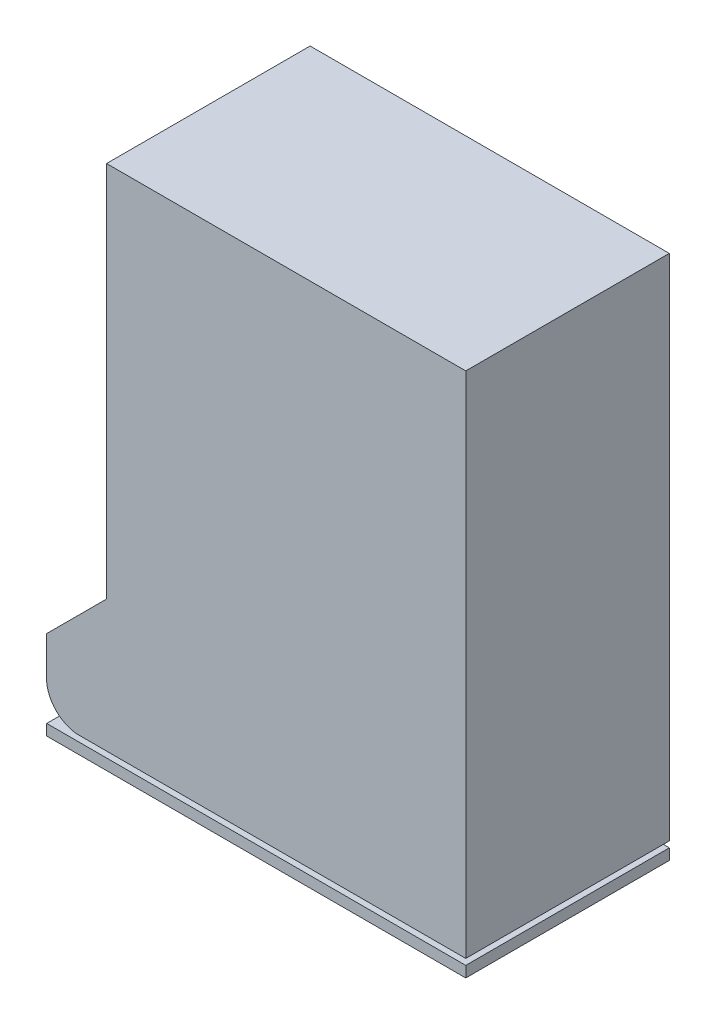
from build123d import *

# Parameters (mm, degrees)
SKETCH1_W            = 56
SKETCH1_H            = 30
BOSS_EXTRUDE1_DEPTH  = 2
SKETCH2_W            = 60
SKETCH2_H            = 34
SKETCH2_W_2          = 56
SKETCH2_H_2          = 30
BOSS_EXTRUDE2_DEPTH  = 85
BOSS_EXTRUDE3_DEPTH  = 10
SKETCH5_W            = 34
SKETCH5_H            = 2
BOSS_EXTRUDE5_DEPTH  = 10
CHAMFER2_SIZE        = 10
BOSS_EXTRUDE6_START  = 2
BOSS_EXTRUDE6_DEPTH  = 8
SKETCH7_R            = 2.25
CUT_EXTRUDE1_DEPTH   = 99.208960895
BOSS_EXTRUDE7_REACH  = 100.209
SKETCH9_R            = 2.25
BOSS_EXTRUDE8_REACH  = 100.209
SKETCH10_R           = 2.25
BOSS_EXTRUDE9_REACH  = 100.209
SKETCH11_R           = 1.75
SKETCH12_W           = 8
SKETCH12_H           = 28.34314575
BOSS_EXTRUDE10_DEPTH = 1
BOSS_EXTRUDE11_DEPTH = 8
SKETCH14_W           = 34
SKETCH14_H           = 1.828427125
BOSS_EXTRUDE12_DEPTH = 62
FILLET1_R            = 4
CUT_EXTRUDE2_REACH   = 102.611
CUT_EXTRUDE3_REACH   = 102.611


# Some blends are built 0.0001 mm under size
with BuildPart() as part:
    # Sketch1 → Boss-Extrude1 (new body)
    with BuildSketch(Plane(origin=(0, 0, 0), x_dir=(1, 0, 0), z_dir=(0, 1, 0))):
        Rectangle(SKETCH1_W, SKETCH1_H)
    extrude(amount=BOSS_EXTRUDE1_DEPTH)

    # Sketch2 → Boss-Extrude2 (add)
    with BuildSketch(Plane(origin=(0, 2, 0), x_dir=(1, 0, 0), z_dir=(0, 1, 0))):
        Rectangle(SKETCH2_W, SKETCH2_H)
        Rectangle(SKETCH2_W_2, SKETCH2_H_2, mode=Mode.SUBTRACT)
    extrude(amount=-BOSS_EXTRUDE2_DEPTH)

    # Sketch3 → Boss-Extrude3 (add)
    with BuildSketch(Plane.ZY.offset(30)):
        Polygon((17, -83), (17, -73), (7.299704714, -73), (7, -73), (7.299704714, -73.299704714), align=None)
        Polygon((-17, -73), (-17, -83), (-10.046245332, -76.046245332), (-7.299704714, -73.299704714), (-7, -73), (-7.299704714, -73), align=None)
    extrude(amount=BOSS_EXTRUDE3_DEPTH)

    # Sketch5 → Boss-Extrude5 (add)
    with BuildSketch(Plane.ZY.offset(30)):
        with Locations((0, -72)):
            Rectangle(SKETCH5_W, SKETCH5_H)
    extrude(amount=BOSS_EXTRUDE5_DEPTH)

    # Chamfer2
    chamfer2_edges = [part.edges().sort_by_distance(p)[0] for p in [
        (-30, -71, 0),
    ]]
    chamfer(chamfer2_edges, length=CHAMFER2_SIZE - 0.0001)  # a hair under: the kernel refuses the full size


with BuildPart() as body_2:
    # Sketch6 → Boss-Extrude6 (new body)
    with BuildSketch(Plane.ZY.offset(30).offset(BOSS_EXTRUDE6_START)):
        Polygon((12.171572875, -81), (14.171572875, -83), (-14.171572875, -83), (-12.171572875, -81), (-6.171572875, -75), (6.171572875, -75), align=None)
    extrude(amount=BOSS_EXTRUDE6_DEPTH)


with BuildPart() as cut_extrude1_tool:
    # Sketch7 → Cut-Extrude1 (new, through all)
    with BuildSketch(Plane.XY.offset(17)):
        with Locations(Location((-36, -79, 0), (0, 0, 270))):
            Circle(SKETCH7_R)
    extrude(amount=-CUT_EXTRUDE1_DEPTH)


with BuildPart() as part_1:
    add(part.part)

    # Cut-Extrude1: cut by cut_extrude1_tool
    add(cut_extrude1_tool.part, mode=Mode.SUBTRACT)

    # Boss-Extrude7: up to this face of the body (flat: up to its plane)
    boss_extrude7_end = Plane(part_1.part.faces().sort_by_distance((-35, -73.122474487, 7.122474487))[0])
    # Sketch9 → Boss-Extrude7 (add, up to the picked face)
    with BuildSketch(Plane.XY.offset(17), mode=Mode.PRIVATE) as boss_extrude7_sk1:
        with Locations(Location((-36, -79, 0), (0, 0, 270))):
            Circle(SKETCH9_R)
    boss_extrude7_tool1 = split(extrude(boss_extrude7_sk1.sketch, amount=-BOSS_EXTRUDE7_REACH, mode=Mode.PRIVATE), bisect_by=boss_extrude7_end, keep=Keep.BOTH, mode=Mode.PRIVATE)
    add(boss_extrude7_tool1.solids().sort_by(Axis((-36, -79, 17), (0, 0, -1)))[0])

    # Boss-Extrude8: up to this face of the body (flat: up to its plane)
    boss_extrude8_end = Plane(part_1.part.faces().sort_by_distance((-35, -82.877525513, -16.877525513))[0])
    # Sketch10 → Boss-Extrude8 (add, up to the picked face)
    with BuildSketch(Plane(origin=(0, 0, -17), x_dir=(-1, 0, 0), z_dir=(0, 0, -1)), mode=Mode.PRIVATE) as boss_extrude8_sk1:
        with Locations(Location((36, -79, 0), (0, 0, 270))):
            Circle(SKETCH10_R)
    boss_extrude8_tool1 = split(extrude(boss_extrude8_sk1.sketch, amount=-BOSS_EXTRUDE8_REACH, mode=Mode.PRIVATE), bisect_by=boss_extrude8_end, keep=Keep.BOTH, mode=Mode.PRIVATE)
    add(boss_extrude8_tool1.solids().sort_by(Axis((-36, -79, -17), (0, 0, 1)))[0])

    # Boss-Extrude9: up to this plane
    boss_extrude9_end = Plane(origin=(-40, -73.299704714, -7.299704714), z_dir=(0, 0.7071067811867726, -0.7071067811863224))
    # Sketch11 → Boss-Extrude9 (add, up to the surface)
    with BuildSketch(Plane.XY.offset(17), mode=Mode.PRIVATE) as boss_extrude9_sk1:
        with Locations(Location((-36, -79, 0), (0, 0, 90))):
            Circle(SKETCH11_R)
    boss_extrude9_tool1 = split(extrude(boss_extrude9_sk1.sketch, amount=-BOSS_EXTRUDE9_REACH, mode=Mode.PRIVATE), bisect_by=boss_extrude9_end, keep=Keep.BOTH, mode=Mode.PRIVATE)
    add(boss_extrude9_tool1.solids().sort_by_distance((-36, -79, 17))[0])

    # Cut-Extrude2: up to this face of the body (flat: up to its plane)
    cut_extrude2_end = Plane(part_1.part.faces().sort_by_distance((-35, -73.122474487, 7.122474487))[0])
    # Sketch15 → Cut-Extrude2 (cut, up to the picked face)
    with BuildSketch(Plane.XY.offset(17), mode=Mode.PRIVATE) as cut_extrude2_sk1:
        with BuildLine():
            Line((-40, -77), (-40.95825687, -78.42919066))
            Line((-40.95825687, -78.42919066), (-40.221590292, -83.192087083))
            Line((-40.221590292, -83.192087083), (-35, -83))
            ThreePointArc((-35, -83), (-38.742640687, -81.035533906), (-40, -77))
        make_face()
    cut_extrude2_tool1 = split(extrude(cut_extrude2_sk1.sketch, amount=-CUT_EXTRUDE2_REACH, mode=Mode.PRIVATE), bisect_by=cut_extrude2_end, keep=Keep.BOTH, mode=Mode.PRIVATE)
    add(cut_extrude2_tool1.solids().sort_by(Axis((-39.293992, -81.193601, 17), (0, 0, -1)))[0], mode=Mode.SUBTRACT)

    # Cut-Extrude3: up to this face of the body (flat: up to its plane)
    cut_extrude3_end = Plane(part_1.part.faces().sort_by_distance((-35, -82.877525513, -16.877525513))[0])
    # Sketch16 → Cut-Extrude3 (cut, up to the picked face)
    with BuildSketch(Plane(origin=(0, 0, -17), x_dir=(-1, 0, 0), z_dir=(0, 0, -1)), mode=Mode.PRIVATE) as cut_extrude3_sk1:
        with BuildLine():
            Line((40, -77), (40.921238038, -77.921238038))
            Line((40.921238038, -77.921238038), (40.171531484, -83.209136239))
            Line((40.171531484, -83.209136239), (35, -83))
            ThreePointArc((35, -83), (38.742640687, -81.035533906), (40, -77))
        make_face()
    cut_extrude3_tool1 = split(extrude(cut_extrude3_sk1.sketch, amount=-CUT_EXTRUDE3_REACH, mode=Mode.PRIVATE), bisect_by=cut_extrude3_end, keep=Keep.BOTH, mode=Mode.PRIVATE)
    add(cut_extrude3_tool1.solids().sort_by(Axis((-39.266002, -81.163478, -17), (0, 0, 1)))[0], mode=Mode.SUBTRACT)


with BuildPart() as body_2_1:
    add(body_2.part)

    # Cut-Extrude1: cut by cut_extrude1_tool
    add(cut_extrude1_tool.part, mode=Mode.SUBTRACT)

    # Sketch12 → Boss-Extrude10 (add)
    with BuildSketch(Plane.XZ.offset(83)):
        with Locations((-36, 0)):
            Rectangle(SKETCH12_W, SKETCH12_H)
    extrude(amount=BOSS_EXTRUDE10_DEPTH)

    # Sketch13 → Boss-Extrude11 (add)
    with BuildSketch(Plane.ZY.offset(40)):
        Polygon((17, -85.828427125), (-17, -85.828427125), (-17, -84), (-15.171572875, -84), (-14.171572875, -83), (-14.171572875, -84), (14.171572875, -84), (14.171572875, -83), (15.171572875, -84), (17, -84), align=None)
    extrude(amount=-BOSS_EXTRUDE11_DEPTH)

    # Sketch14 → Boss-Extrude12 (add)
    with BuildSketch(Plane(origin=(-32, 0, 0), x_dir=(0, 0, -1), z_dir=(1, 0, 0))):
        with Locations((0, -84.914213563)):
            Rectangle(SKETCH14_W, SKETCH14_H)
    extrude(amount=BOSS_EXTRUDE12_DEPTH)

    # Fillet1
    # the kernel refuses this fillet: 4 mm, written as the material it takes off along each edge
    with BuildSketch(Plane(origin=(-40, -67.928932188, -0.899494937), x_dir=(1, 0, 0), z_dir=(0, -0.7071067811865429, 0.7071067811865522))) as fillet1_piece_1_section:
        with BuildLine():
            CenterArc((FILLET1_R, -FILLET1_R), FILLET1_R, 90, 90)
            Line((0, -FILLET1_R), (0, 0))
            Line((0, 0), (FILLET1_R, 0))
        make_face()
    fillet1_piece_1 = extrude(amount=32.727922061, mode=Mode.PRIVATE)
    fillet1_piece_1 = split(fillet1_piece_1, bisect_by=Plane(origin=(-39.176171252, -84, 9.384724786), z_dir=(0, 1, 0)), keep=Keep.TOP, mode=Mode.PRIVATE)
    add(fillet1_piece_1, mode=Mode.SUBTRACT)
    with BuildSketch(Plane(origin=(-32, -91.071067812, 22.242640687), x_dir=(-1, 0, 0), z_dir=(0, 0.7071067811865429, -0.7071067811865522))) as fillet1_piece_2_section:
        with BuildLine():
            CenterArc((FILLET1_R, -FILLET1_R), FILLET1_R, 90, 90)
            Line((0, -FILLET1_R), (0, 0))
            Line((0, 0), (FILLET1_R, 0))
        make_face()
    fillet1_piece_2 = extrude(amount=32.727922061, mode=Mode.PRIVATE)
    fillet1_piece_2 = split(fillet1_piece_2, bisect_by=Plane(origin=(-32.823830813, -84, 9.384729288), z_dir=(0, 1, 0)), keep=Keep.TOP, mode=Mode.PRIVATE)
    add(fillet1_piece_2, mode=Mode.SUBTRACT)
    with BuildSketch(Plane(origin=(-32, -91.071067812, -22.242640687), x_dir=(-1, 0, 0), z_dir=(0, 0.7071067811865529, 0.7071067811865422))) as fillet1_piece_3_section:
        with BuildLine():
            CenterArc((FILLET1_R, FILLET1_R), FILLET1_R, 180, 90)
            Line((0, FILLET1_R), (0, 0))
            Line((0, 0), (FILLET1_R, 0))
        make_face()
    fillet1_piece_3 = extrude(amount=32.727922061, mode=Mode.PRIVATE)
    fillet1_piece_3 = split(fillet1_piece_3, bisect_by=Plane(origin=(-32.823830813, -84, -9.384729288), z_dir=(0, 1, 0)), keep=Keep.TOP, mode=Mode.PRIVATE)
    add(fillet1_piece_3, mode=Mode.SUBTRACT)
    with BuildSketch(Plane(origin=(-40, -67.928932188, 0.899494937), x_dir=(1, 0, 0), z_dir=(0, -0.7071067811865529, -0.7071067811865422))) as fillet1_piece_4_section:
        with BuildLine():
            CenterArc((FILLET1_R, FILLET1_R), FILLET1_R, 180, 90)
            Line((0, FILLET1_R), (0, 0))
            Line((0, 0), (FILLET1_R, 0))
        make_face()
    fillet1_piece_4 = extrude(amount=32.727922061, mode=Mode.PRIVATE)
    fillet1_piece_4 = split(fillet1_piece_4, bisect_by=Plane(origin=(-39.176171252, -84, -9.384724786), z_dir=(0, 1, 0)), keep=Keep.TOP, mode=Mode.PRIVATE)
    add(fillet1_piece_4, mode=Mode.SUBTRACT)
    with BuildSketch(Plane(origin=(-40, -75, -16.171572875), x_dir=(0, -1, 0), z_dir=(0, 0, 1))) as fillet1_piece_5:
        with BuildLine():
            CenterArc((FILLET1_R, FILLET1_R), FILLET1_R, 180, 90)
            Line((0, FILLET1_R), (0, 0))
            Line((0, 0), (FILLET1_R, 0))
        make_face()
    extrude(amount=32.343145751, mode=Mode.SUBTRACT)
    with BuildSketch(Plane(origin=(-32, -75, -16.171572875), x_dir=(0, -1, 0), z_dir=(0, 0, 1))) as fillet1_piece_6:
        with BuildLine():
            CenterArc((FILLET1_R, -FILLET1_R), FILLET1_R, 90, 90)
            Line((0, -FILLET1_R), (0, 0))
            Line((0, 0), (FILLET1_R, 0))
        make_face()
    extrude(amount=32.343145751, mode=Mode.SUBTRACT)


solid = Compound([part_1.part, body_2_1.part])
